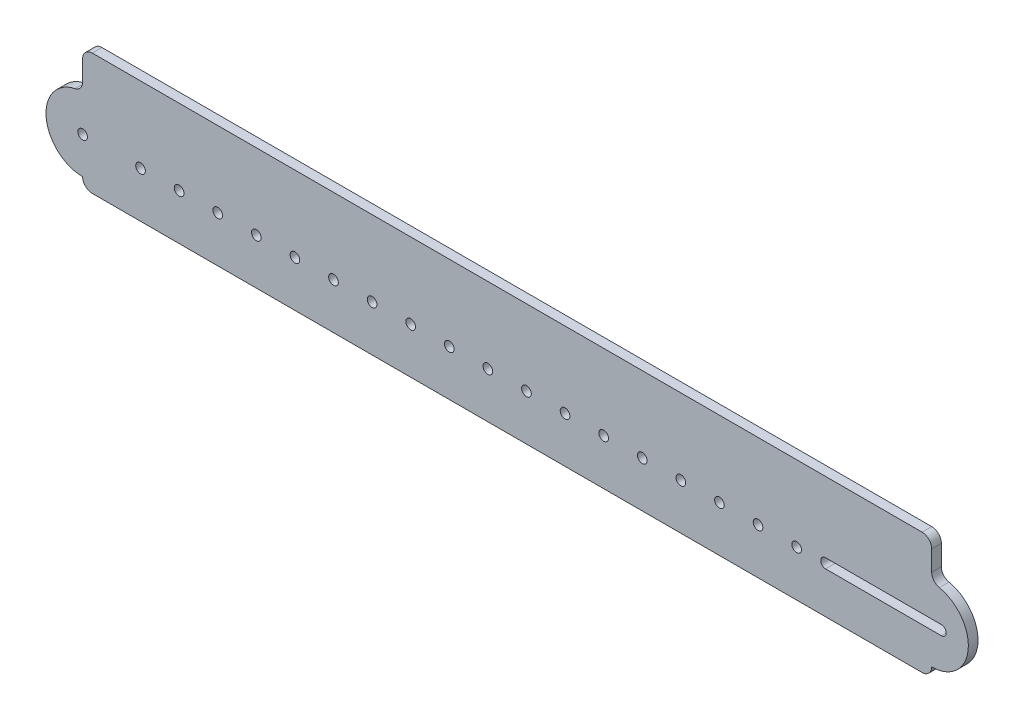
from build123d import *

# Parameters (mm, degrees)
SKETCH1_W           = 558.8
SKETCH1_H           = 25.4
SKETCH1_H_2         = 6.35
BOSS_EXTRUDE1_DEPTH = 3.175
SKETCH2_R           = 3.175
CUT_EXTRUDE1_DEPTH  = 586.064892384
FILLET1_R           = 6.35


with BuildPart() as part:
    # Sketch1 → Boss-Extrude1 (new, symmetric)
    with BuildSketch(Plane.XY):
        with Locations((279.4, 36.83)):
            Rectangle(SKETCH1_W, SKETCH1_H)
        with BuildLine():
            Line((0, -24.13), (558.8, -24.13))
            ThreePointArc((558.8, -24.13), (582.93, 0), (558.8, 24.13))
            Line((558.8, 24.13), (0, 24.13))
            ThreePointArc((0, 24.13), (-24.13, 0), (0, -24.13))
        make_face()
        with Locations((279.4, -27.305)):
            Rectangle(SKETCH1_W, SKETCH1_H_2)
    extrude(amount=BOSS_EXTRUDE1_DEPTH, both=True)

    # Sketch2 → Cut-Extrude1 (cut, through all)
    with BuildSketch(Plane.XY.offset(3.175)):
        with Locations((0.000865133, 0)):
            Circle(SKETCH2_R)
        with Locations((38.1, -0.256753551)):
            Circle(SKETCH2_R)
        with Locations((63.5, -0.256753551)):
            Circle(SKETCH2_R)
        with Locations((88.9, -0.256753551)):
            Circle(SKETCH2_R)
        with Locations((114.3, -0.256753551)):
            Circle(SKETCH2_R)
        with Locations((139.7, -0.256753551)):
            Circle(SKETCH2_R)
        with Locations((165.1, -0.256753551)):
            Circle(SKETCH2_R)
        with Locations((190.5, -0.256753551)):
            Circle(SKETCH2_R)
        with Locations((215.9, -0.256753551)):
            Circle(SKETCH2_R)
        with Locations((241.3, -0.256753551)):
            Circle(SKETCH2_R)
        with Locations((266.7, -0.256753551)):
            Circle(SKETCH2_R)
        with Locations((292.1, -0.256753551)):
            Circle(SKETCH2_R)
        with Locations((317.5, -0.256753551)):
            Circle(SKETCH2_R)
        with Locations((342.9, -0.256753551)):
            Circle(SKETCH2_R)
        with Locations((368.3, -0.256753551)):
            Circle(SKETCH2_R)
        with Locations((393.7, -0.256753551)):
            Circle(SKETCH2_R)
        with Locations((419.1, -0.256753551)):
            Circle(SKETCH2_R)
        with Locations((444.5, -0.256753551)):
            Circle(SKETCH2_R)
        with Locations((469.9, -0.256753551)):
            Circle(SKETCH2_R)
        with BuildLine():
            Line((488.95, 3.175), (565.15, 3.175))
            ThreePointArc((565.15, 3.175), (568.325, 0), (565.15, -3.175))
            Line((565.15, -3.175), (488.95, -3.175))
            ThreePointArc((488.95, -3.175), (485.775, 0), (488.95, 3.175))
        make_face()
    extrude(amount=-CUT_EXTRUDE1_DEPTH, mode=Mode.SUBTRACT)

    # Fillet1
    fillet1_edges = [part.edges().sort_by_distance(p)[0] for p in [
        (558.8, 49.53, 0),
        (558.8, 24.13, 0),
        (0, 24.13, 0),
        (0, 49.53, 0),
        (0, -30.48, 0),
        (558.8, -30.48, 0),
    ]]
    fillet(fillet1_edges, radius=FILLET1_R - 0.0001)  # a hair under: the kernel refuses the full size


solid = part.part
